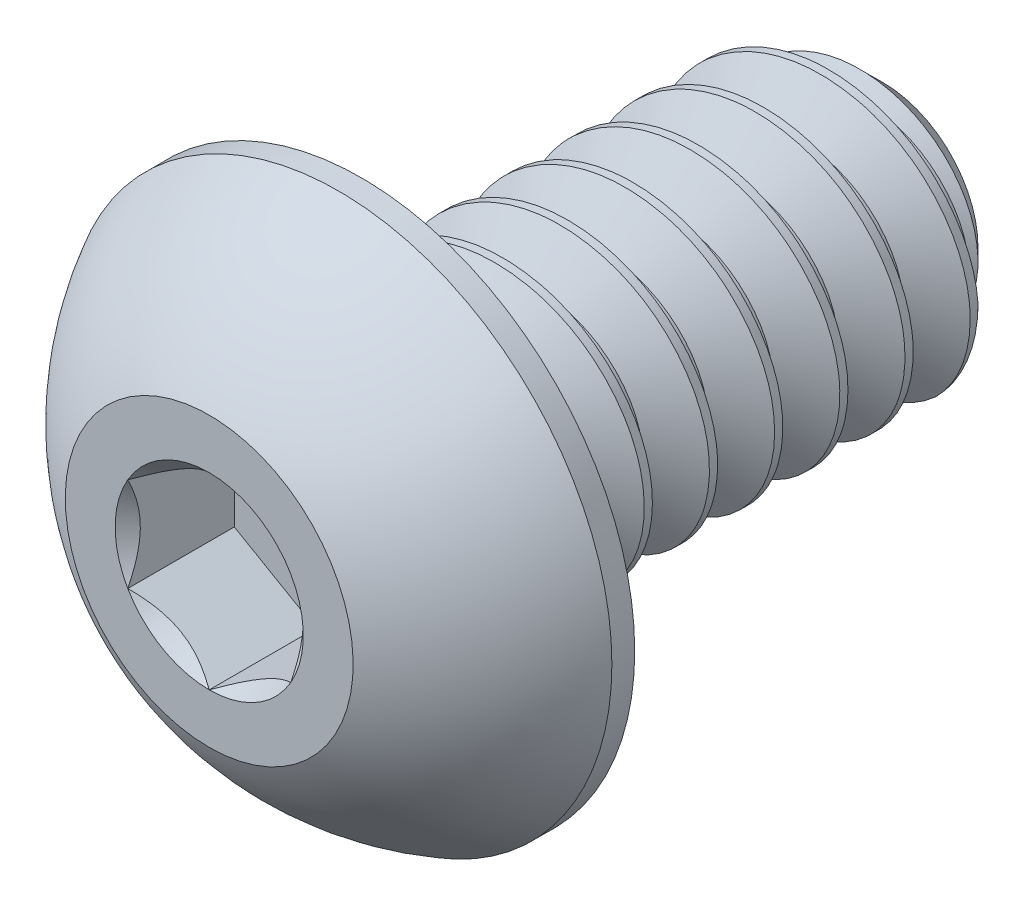
from build123d import *

# Parameters (mm, degrees)
SKETCH1_W          = 6.35
SKETCH1_H          = 1.7526
CHAMFER1_SIZE      = 0.5953125
CUT_SWEEP1_PITCH   = 0.79375
CUT_EXTRUDE2_DEPTH = 1.29794


with BuildPart() as part:
    # Sketch1 → Revolve1 (revolve)
    with BuildSketch(Plane(origin=(0, 0, 0), x_dir=(0, 0, -1), z_dir=(1, 0, 0))):
        with Locations((5.0292, 0.8763)):
            Rectangle(SKETCH1_W, SKETCH1_H)
    revolve(axis=Axis((0, 0, -8.2042), (0, 0, 1)))

    # Chamfer1
    chamfer1_edges = [part.edges().sort_by_distance(p)[0] for p in [
        (0, -1.7526, -8.2042),
    ]]
    chamfer(chamfer1_edges, length=CHAMFER1_SIZE)

    # Cut-Sweep1: the profile of Sketch2 profile screwed along a right-hand helix of 9 turns, 8 arcs to a turn; built about Z, then put on its axis
    cut_sweep1_z = Axis((0, 0, 0), (0, 0, 1))
    cut_sweep1_corners = [(1.7529, 0, 0.000173205), (1.7529, 0, -0.694704455), (1.237044252, 0, -0.396875), (1.237044252, 0, -0.29765625)]
    with BuildLine(mode=Mode.PRIVATE) as cut_sweep1_profile:
        Line(cut_sweep1_corners[0], cut_sweep1_corners[1])
        Line(cut_sweep1_corners[1], cut_sweep1_corners[2])
        Line(cut_sweep1_corners[2], cut_sweep1_corners[3])
        Line(cut_sweep1_corners[3], cut_sweep1_corners[0])
    cut_sweep1_cap = Face(cut_sweep1_profile.wire())
    cut_sweep1_turn_angles = [0, 22.5, 45, 67.5, 90, 112.5, 135, 157.5, 180, 202.5, 225, 247.5, 270, 292.5, 315, 337.5, 360]
    cut_sweep1_turn_weights = [1, 0.9238795325112867, 1, 0.9238795325112867, 1, 0.9238795325112867, 1, 0.9238795325112867, 1, 0.9238795325112867, 1, 0.9238795325112867, 1, 0.9238795325112867, 1, 0.9238795325112867, 1]
    cut_sweep1_turn_rails = [Edge.make_bspline([Vector(p[0], p[1], 0).rotate(cut_sweep1_z, cut_sweep1_turn_angles[k]) / cut_sweep1_turn_weights[k] + Vector(0, 0, p[2] + CUT_SWEEP1_PITCH * cut_sweep1_turn_angles[k] / 360) for k in range(17)], [0, 0, 0, 1, 1, 2, 2, 3, 3, 4, 4, 5, 5, 6, 6, 7, 7, 8, 8, 8], 2, cut_sweep1_turn_weights) for p in cut_sweep1_corners]
    cut_sweep1_turn_sides = [Face.make_surface_from_curves(cut_sweep1_turn_rails[p[0]], cut_sweep1_turn_rails[p[1]]) for p in [(0, 1), (1, 2), (2, 3), (3, 0)]]
    cut_sweep1 = Plane(origin=(0, 0, -8.2042), x_dir=(0, 1, 0), z_dir=(0, 0, 1)) * Solid(Shell([*[p.moved(Location((0, 0, CUT_SWEEP1_PITCH * i))) for i in range(9) for p in cut_sweep1_turn_sides], cut_sweep1_cap, cut_sweep1_cap.rotate(cut_sweep1_z, 3240).moved(Location((0, 0, CUT_SWEEP1_PITCH * 3240 / 360)))]))
    add(cut_sweep1, mode=Mode.SUBTRACT)

    # Sketch7 → Revolve2 (revolve)
    with BuildSketch(Plane(origin=(0, 0, 0), x_dir=(0, 0, -1), z_dir=(1, 0, 0)), mode=Mode.PRIVATE) as revolve2_sk:
        with BuildLine():
            Line((1.57607, 3.3274), (1.8542, 3.3274))
            Line((1.8542, 3.3274), (1.8542, 0))
            Line((1.8542, 0), (0, 0))
            Line((0, 0), (0, 1.7526))
            ThreePointArc((0, 1.7526), (0.668695369, 2.659435873), (1.57607, 3.3274))
        make_face()
    revolve(revolve2_sk.sketch.rotate(Axis((0, 0, 0), (0, 0, -1)), 189.052465709), axis=Axis((0, 0, 0), (0, 0, -1)))

    # Sketch5 → Cut-Extrude2 (cut)
    with BuildSketch(Plane.XY):
        Polygon((0.9921875, -0.57283972), (0.9921875, 0.57283972), (0, 1.14567944), (-0.9921875, 0.57283972), (-0.9921875, -0.57283972), (0, -1.14567944), align=None)
    extrude(amount=-CUT_EXTRUDE2_DEPTH, mode=Mode.SUBTRACT)

    # Cut-Extrude3 cone 1 section (through the dimple's axis) → Cut-Extrude3 (revolve, cut)
    with BuildSketch(Plane(origin=(0, 0, 0), x_dir=(0, -1, 0), z_dir=(1, 0, 0))):
        Polygon((0, 0), (1.14567944, 0), (0, 1.14567944), align=None)
    revolve(axis=Axis((0, 0, 0), (0, 0, -1)), mode=Mode.SUBTRACT)


solid = part.part
